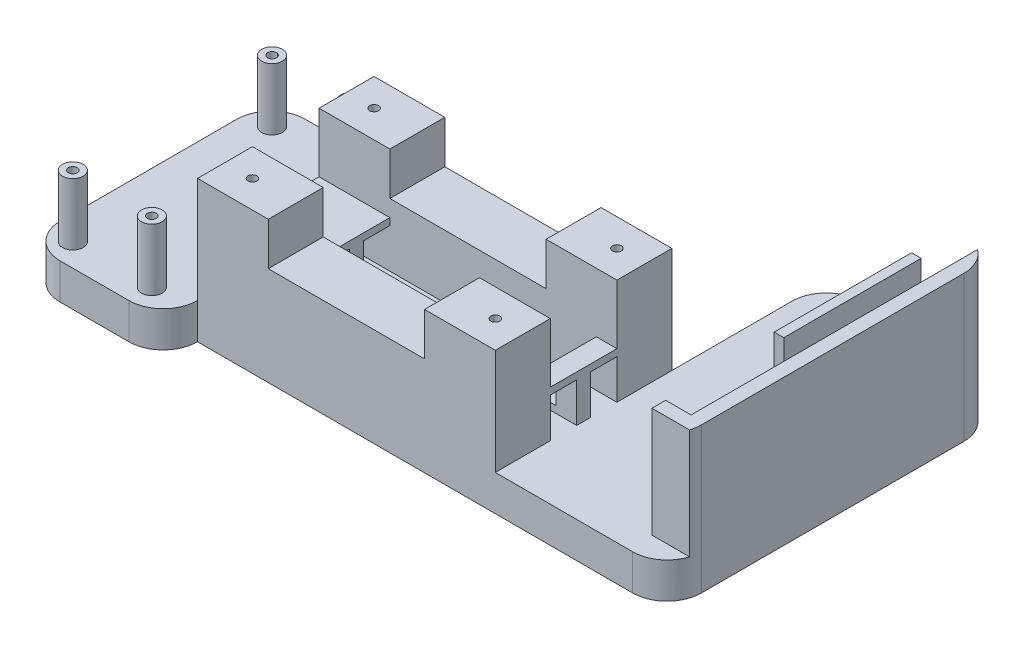
from build123d import *

# Parameters (mm, degrees)
EXTRUDE_1_DEPTH     = 16
F_1_0MM_1_D         = 2.6
F_1_0MM_2_D         = 2.6
SKETCH_8_W          = 86.7
SKETCH_8_H          = 16
EXTRUDE_2_DEPTH     = 21.2
SKETCH_9_W          = 86.7
SKETCH_9_H          = 10.4
EXTRUDE_3_DEPTH     = 9.7
SKETCH_15_W         = 20.6
SKETCH_15_H         = 2
EXTRUDE_8_DEPTH     = 13.5
SKETCH_16_W         = 20.6
SKETCH_16_H         = 2
EXTRUDE_9_DEPTH     = 10.5
SKETCH_19_W         = 51.4
SKETCH_19_H         = 10.4
EXTRUDE_10_DEPTH    = 50
SKETCH_25_W         = 50
SKETCH_25_H         = 10.4
EXTRUDE_11_DEPTH    = 45
EXTRUDE_12_DEPTH    = 32
CUT_EXTRUDE_1_DEPTH = 5
SKETCH_29_W         = 51.4
SKETCH_29_H         = 10.402970243
EXTRUDE_13_DEPTH    = 40
SKETCH_32_W         = 40
SKETCH_32_H         = 10.402970243
EXTRUDE_14_DEPTH    = 10
SKETCH_33_W         = 40
SKETCH_33_H         = 10.402970243
EXTRUDE_15_DEPTH    = 10
SKETCH_34_R         = 3
EXTRUDE_16_DEPTH    = 18
F_1_0MM_3_D         = 2.6
F_1_0MM_4_D         = 2.6
FILLET_1_R          = 10
FILLET_2_R          = 10
SKETCH_40_W         = 6
SKETCH_40_H         = 4
EXTRUDE_17_DEPTH    = 11.5
SKETCH_42_W         = 6
SKETCH_42_H         = 19.4
EXTRUDE_18_DEPTH    = 2
SKETCH_46_W         = 60.1
SKETCH_46_H         = 4
EXTRUDE_19_DEPTH    = 2


with BuildPart() as part:
    # 草图1 → 凸台-拉伸1 (new body)
    with BuildSketch(Plane.XY):
        Polygon((-21.523113208, 25.59839861), (-42.123113208, 25.59839861), (-42.123113208, 5.59839861), (44.576886792, 5.59839861), (44.576886792, 25.59839861), (23.976886792, 25.59839861), (23.976886792, 13.12839861), (-21.523113208, 13.12839861), align=None)
    extrude_1 = extrude(amount=EXTRUDE_1_DEPTH)

    # Ø1.0mm 暗销孔1 (through all)
    with Locations(Plane(origin=(0, 25.59839861, 0), x_dir=(1, 0, 0), z_dir=(0, 1, 0))):
        with Locations((36.576886792, -8)):
            f_1_0mm_1 = Hole(F_1_0MM_1_D / 2)

    # Ø1.0mm 暗销孔2 (through all)
    with Locations(Plane(origin=(0, 25.59839861, 0), x_dir=(1, 0, 0), z_dir=(0, 1, 0))):
        with Locations((-34.123113208, -8)):
            f_1_0mm_2 = Hole(F_1_0MM_2_D / 2)

    # 草图8 → 凸台-拉伸2 (add)
    with BuildSketch(Plane.XZ.offset(-5.59839861)):
        with Locations((1.226886792, 8)):
            Rectangle(SKETCH_8_W, SKETCH_8_H)
    extrude_2 = extrude(amount=EXTRUDE_2_DEPTH)

    # 草图9 → 凸台-拉伸3 (add)
    with BuildSketch(Plane(origin=(0, 0, 0), x_dir=(-1, 0, 0), z_dir=(0, 0, -1))):
        with Locations((-1.226886792, -10.40160139)):
            Rectangle(SKETCH_9_W, SKETCH_9_H)
    extrude_3 = extrude(amount=EXTRUDE_3_DEPTH)

    # 草图15 → 凸台-拉伸8 (add)
    with BuildSketch(Plane(origin=(0, -5.20160139, 0), x_dir=(1, 0, 0), z_dir=(0, 1, 0))):
        with Locations((-31.823113208, 8.7)):
            Rectangle(SKETCH_15_W, SKETCH_15_H)
    extrude_8 = extrude(amount=EXTRUDE_8_DEPTH)

    # 草图16 → 凸台-拉伸9 (add)
    with BuildSketch(Plane(origin=(0, 0, -9.7), x_dir=(-1, 0, 0), z_dir=(0, 0, -1))):
        with Locations((31.823113208, 7.29839861)):
            Rectangle(SKETCH_16_W, SKETCH_16_H)
    extrude_9 = extrude(amount=-EXTRUDE_9_DEPTH)

    # 镜向20: 凸台-拉伸1, Ø1.0mm 暗销孔1, Ø1.0mm 暗销孔2, 凸台-拉伸2, 凸台-拉伸3, 凸台-拉伸8, 凸台-拉伸9 across plane
    add(extrude_1.mirror(Plane.XY.offset(-9.7)))
    add(f_1_0mm_1.mirror(Plane.XY.offset(-9.7)), mode=Mode.SUBTRACT)
    add(f_1_0mm_2.mirror(Plane.XY.offset(-9.7)), mode=Mode.SUBTRACT)
    add(extrude_2.mirror(Plane.XY.offset(-9.7)))
    add(extrude_3.mirror(Plane.XY.offset(-9.7)))
    add(extrude_8.mirror(Plane.XY.offset(-9.7)))
    add(extrude_9.mirror(Plane.XY.offset(-9.7)))

    # 草图19 → 凸台-拉伸10 (add)
    with BuildSketch(Plane(origin=(44.576886792, 0, 0), x_dir=(0, 0, -1), z_dir=(1, 0, 0))):
        with Locations((9.7, -10.40160139)):
            Rectangle(SKETCH_19_W, SKETCH_19_H)
    extrude(amount=EXTRUDE_10_DEPTH)

    # 草图25 → 凸台-拉伸11 (add)
    with BuildSketch(Plane(origin=(0, 0, -35.4), x_dir=(-1, 0, 0), z_dir=(0, 0, -1))):
        with Locations((-69.576886792, -10.40160139)):
            Rectangle(SKETCH_25_W, SKETCH_25_H)
    extrude(amount=EXTRUDE_11_DEPTH)

    # 草图26 → 凸台-拉伸12 (add)
    with BuildSketch(Plane(origin=(0, -5.20160139, 0), x_dir=(1, 0, 0), z_dir=(0, 1, 0))):
        Polygon((83.176886792, -9), (94.576886792, -9), (94.576886792, -5), (94.576886792, 80.4), (90.576886792, 80.4), (90.576886792, -5), (83.176886792, -5), align=None)
        Polygon((83.176886792, 28), (84.576886792, 28), (84.576886792, 68), (83.176886792, 68), (81.776886792, 68), (81.776886792, 28), align=None)
    extrude(amount=EXTRUDE_12_DEPTH)

    # 草图28 → 切除-拉伸1 (cut)
    with BuildSketch(Plane(origin=(0, -5.20160139, 0), x_dir=(1, 0, 0), z_dir=(0, 1, 0))):
        Polygon((90.576886792, -5), (84.576886792, -5), (82.576886792, -5), (82.576886792, 28), (84.576886792, 28), (84.576886792, 80.4), (90.576886792, 80.4), align=None)
    extrude(amount=-CUT_EXTRUDE_1_DEPTH, mode=Mode.SUBTRACT)

    # 草图29 → 凸台-拉伸13 (add)
    with BuildSketch(Plane.ZY.offset(42.123113208)):
        with Locations((-9.7, -10.400116268)):
            Rectangle(SKETCH_29_W, SKETCH_29_H)
    extrude(amount=EXTRUDE_13_DEPTH)

    # 草图32 → 凸台-拉伸14 (add)
    with BuildSketch(Plane(origin=(0, 0, -35.4), x_dir=(-1, 0, 0), z_dir=(0, 0, -1))):
        with Locations((62.123113208, -10.400116268)):
            Rectangle(SKETCH_32_W, SKETCH_32_H)
    extrude(amount=EXTRUDE_14_DEPTH)

    # 草图33 → 凸台-拉伸15 (add)
    with BuildSketch(Plane.XY.offset(16)):
        with Locations((-62.123113208, -10.400116268)):
            Rectangle(SKETCH_33_W, SKETCH_33_H)
    extrude(amount=EXTRUDE_15_DEPTH)

    # 草图34 → 凸台-拉伸16 (add)
    with BuildSketch(Plane(origin=(0, -5.198631147, 0), x_dir=(1, 0, 0), z_dir=(0, 1, 0))):
        with Locations(Location((-52.123113208, 38.7, 0), (0, 0, 90))):
            Circle(SKETCH_34_R)
        with Locations(Location((-75.123113208, 38.7, 0), (0, 0, 90))):
            Circle(SKETCH_34_R)
        with Locations(Location((-52.123113208, -19.3, 0), (0, 0, 90))):
            Circle(SKETCH_34_R)
        with Locations(Location((-75.123113208, -19.3, 0), (0, 0, 90))):
            Circle(SKETCH_34_R)
    extrude(amount=EXTRUDE_16_DEPTH)

    # Ø1.0mm 暗销孔3 (through all)
    with Locations(Plane(origin=(0, 12.801368853, 0), x_dir=(1, 0, 0), z_dir=(0, 1, 0))):
        with Locations((-52.123113208, 38.7)):
            Hole(F_1_0MM_3_D / 2)

    # Ø1.0mm 暗销孔4 (through all)
    with Locations(Plane(origin=(0, 12.801368853, 0), x_dir=(1, 0, 0), z_dir=(0, 1, 0))):
        with Locations((-52.123113208, -19.3), (-75.123113208, 38.7), (-75.123113208, -19.3)):
            Hole(F_1_0MM_4_D / 2)

    # 圆角1
    fillet_1_edges = [part.edges().sort_by_distance(p)[0] for p in [
        (44.576886792, -10.40160139, -80.4),
        (94.576886792, -10.40160139, 16),
        (-42.123113208, -10.400116268, -45.4),
        (-42.123113208, -10.400116268, 26),
        (-82.123113208, -10.400116268, -45.4),
        (-82.123113208, -10.400116268, 26),
    ]]
    fillet(fillet_1_edges, radius=FILLET_1_R - 0.0001)  # a hair under: the kernel refuses the full size

    # 圆角2
    fillet_2_edges = [part.edges().sort_by_distance(p)[0] for p in [
        (94.576886792, 5.59839861, -80.4),
    ]]
    fillet(fillet_2_edges, radius=FILLET_2_R - 0.0001)  # a hair under: the kernel refuses the full size

    # 草图40 → 凸台-拉伸17 (add)
    with BuildSketch(Plane(origin=(0, -5.20160139, 0), x_dir=(1, 0, 0), z_dir=(0, 1, 0))):
        with Locations((41.576886792, 9.7)):
            Rectangle(SKETCH_40_W, SKETCH_40_H)
    extrude(amount=EXTRUDE_17_DEPTH)

    # 草图42 → 凸台-拉伸18 (add)
    with BuildSketch(Plane(origin=(0, 6.29839861, 0), x_dir=(1, 0, 0), z_dir=(0, 1, 0))):
        with Locations((41.576886792, 9.7)):
            Rectangle(SKETCH_42_W, SKETCH_42_H)
    extrude(amount=EXTRUDE_18_DEPTH)

    # 草图46 → 凸台-拉伸19 (add)
    with BuildSketch(Plane(origin=(0, -5.20160139, 0), x_dir=(1, 0, 0), z_dir=(0, 1, 0))):
        with Locations((8.526886792, 9.7)):
            Rectangle(SKETCH_46_W, SKETCH_46_H)
    extrude(amount=EXTRUDE_19_DEPTH)


solid = part.part
